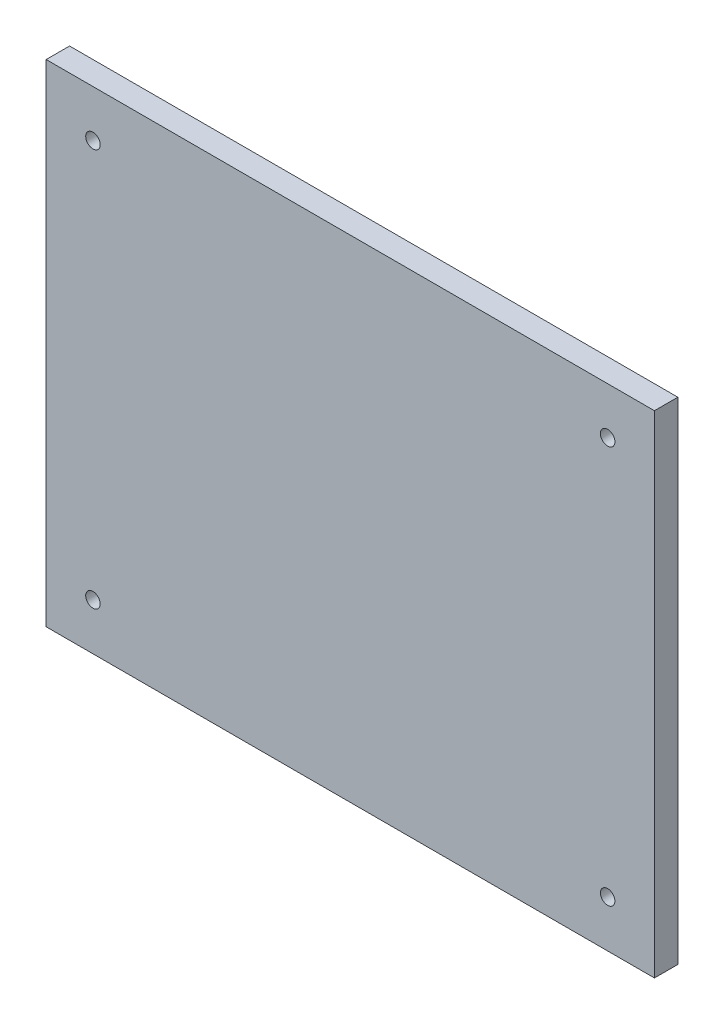
from build123d import *

# Parameters (mm, degrees)
ESQUISSE1_W        = 130
ESQUISSE1_H        = 105
ESQUISSE1_R        = 1.55
BOSS_EXTRU_1_DEPTH = 5


with BuildPart() as part:
    # Esquisse1 → Boss.-Extru.1 (new body)
    with BuildSketch(Plane.XY):
        Rectangle(ESQUISSE1_W, ESQUISSE1_H)
        with Locations((55, -42.5)):
            Circle(ESQUISSE1_R, mode=Mode.SUBTRACT)
        with Locations((-55, -42.5)):
            Circle(ESQUISSE1_R, mode=Mode.SUBTRACT)
        with Locations((-55, 42.5)):
            Circle(ESQUISSE1_R, mode=Mode.SUBTRACT)
        with Locations((55, 42.5)):
            Circle(ESQUISSE1_R, mode=Mode.SUBTRACT)
    extrude(amount=BOSS_EXTRU_1_DEPTH)


solid = part.part
